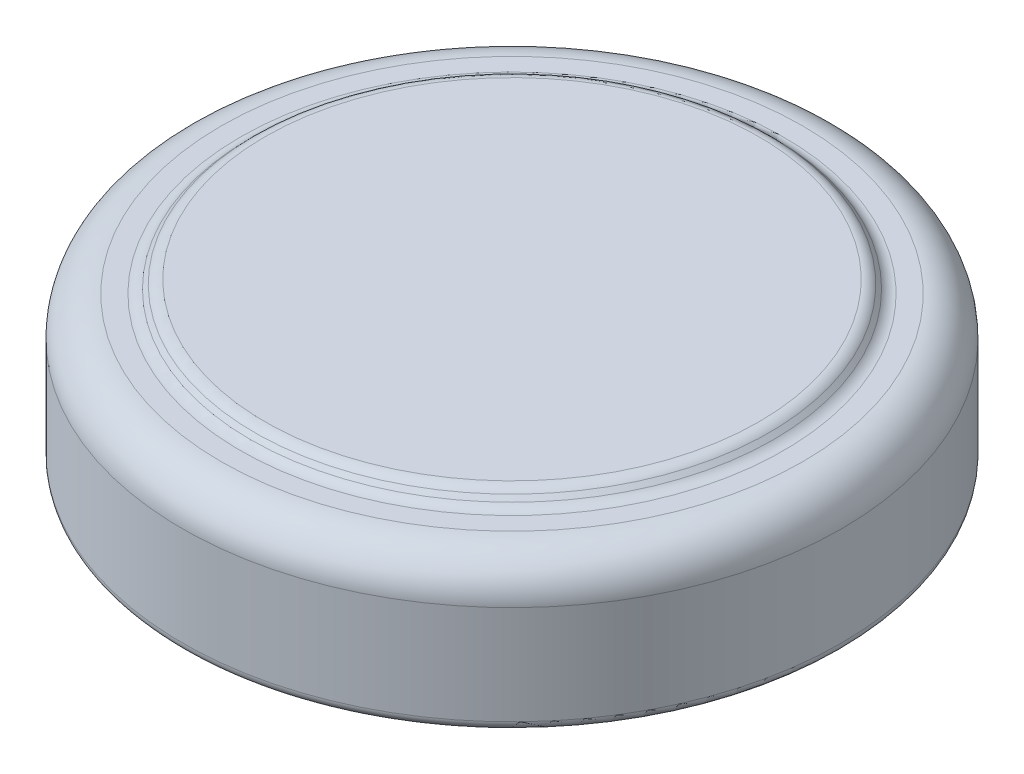
from build123d import *


with BuildPart() as part:
    # Sketch1 → Revolve1 (revolve)
    with BuildSketch(Plane.XY):
        with BuildLine():
            Line((0, 0), (-3.3, 0))
            ThreePointArc((-3.3, 0), (-3.370710678, 0.029289322), (-3.4, 0.1))
            Line((-3.4, 0.1), (-3.4, 1.12))
            ThreePointArc((-3.4, 1.12), (-3.282842712, 1.402842712), (-3, 1.52))
            Line((-3, 1.52), (-2.802132034, 1.52))
            ThreePointArc((-2.802132034, 1.52), (-2.74472952, 1.53141807), (-2.696066017, 1.563933983))
            Line((-2.696066017, 1.563933983), (-2.653933983, 1.606066017))
            ThreePointArc((-2.653933983, 1.606066017), (-2.60527048, 1.63858193), (-2.547867966, 1.65))
            Line((-2.547867966, 1.65), (0, 1.65))
            Line((0, 1.65), (0, 0))
        make_face()
    revolve(axis=Axis((0, 1.65, 0), (0, -1, 0)))


solid = part.part
